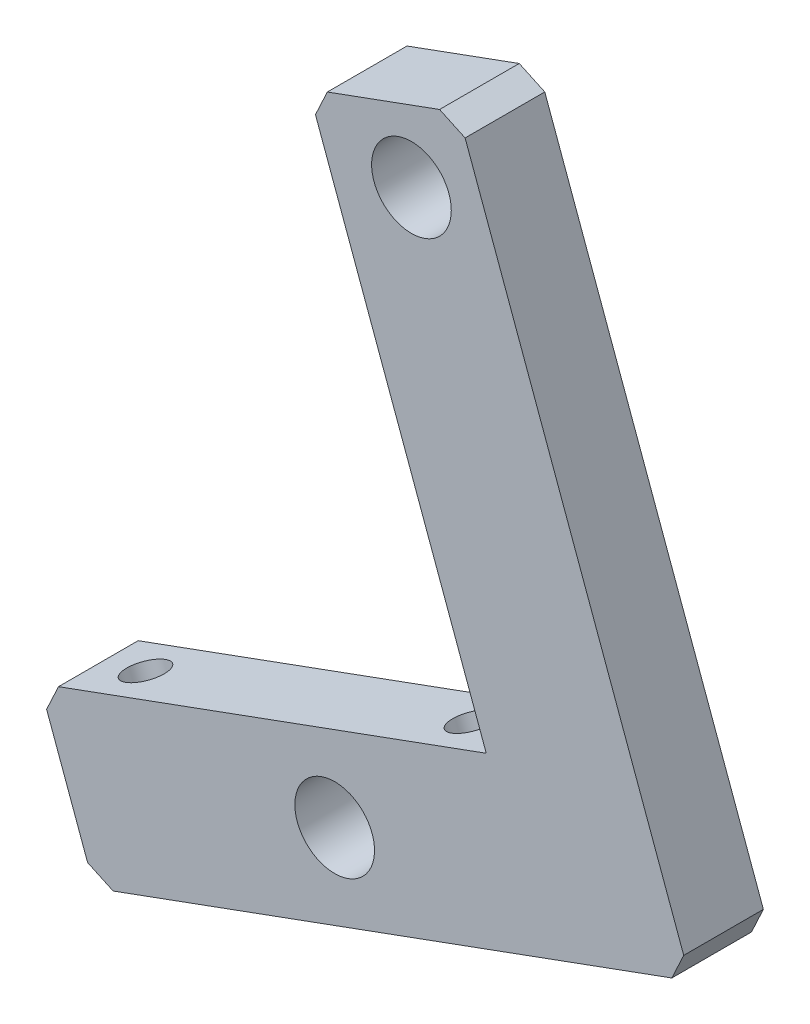
from build123d import *

# Parameters (mm, degrees)
SKETCH_1_R          = 5
EXTRUDE_1_DEPTH     = 10
SKETCH_2_R          = 2.5
CUT_EXTRUDE_2_DEPTH = 113.740370876
CHAMFER_1_SIZE      = 2.5
SKETCH_3_R          = 5
CUT_EXTRUDE_3_DEPTH = 127.834980714


with BuildPart() as part:
    # 草圖1 → 填料-伸長1 (new body)
    with BuildSketch(Plane.XY):
        Polygon((-29.956118011, 9.755168573), (-48.742646001, 2.894675435), (-26.446043305, -58.161540532), (-82.490240349, -78.627846462), (-75.629747212, -97.414374452), (-0.799022178, -70.087575384), align=None)
        with Locations((-35.835723415, -1.346100652)):
            Circle(SKETCH_1_R, mode=Mode.SUBTRACT)
    extrude(amount=EXTRUDE_1_DEPTH)

    # 草圖2 → 除料-伸長2 (cut, through all)
    with BuildSketch(Plane(origin=(15.628555148, -42.796674065, 0), x_dir=(0.9393263994919209, 0.3430246568652819, 0), z_dir=(-0.3430246568652819, 0.939326399491921, 0))):
        with Locations((-95.671540667, -4.982155923)):
            Circle(SKETCH_2_R)
        with Locations((-52.126292594, -4.982155923)):
            Circle(SKETCH_2_R)
    extrude(amount=-CUT_EXTRUDE_2_DEPTH, mode=Mode.SUBTRACT)

    # 導角1
    chamfer_1_edges = [part.edges().sort_by_distance(p)[0] for p in [
        (-29.956118011, 9.755168573, 5),
        (-48.742646001, 2.894675435, 5),
        (-0.799022178, -70.087575384, 5),
        (-75.629747212, -97.414374452, 5),
        (-82.490240349, -78.627846462, 5),
    ]]
    chamfer(chamfer_1_edges, length=CHAMFER_1_SIZE)

    # 草圖3 → 除料-伸長3 (cut, through all)
    with BuildSketch(Plane(origin=(0, 0, 0), x_dir=(-1, 0, 0), z_dir=(0, 0, -1))):
        with Locations((45.470290058, -75.754770876)):
            Circle(SKETCH_3_R)
    extrude(amount=-CUT_EXTRUDE_3_DEPTH, mode=Mode.SUBTRACT)


solid = part.part
